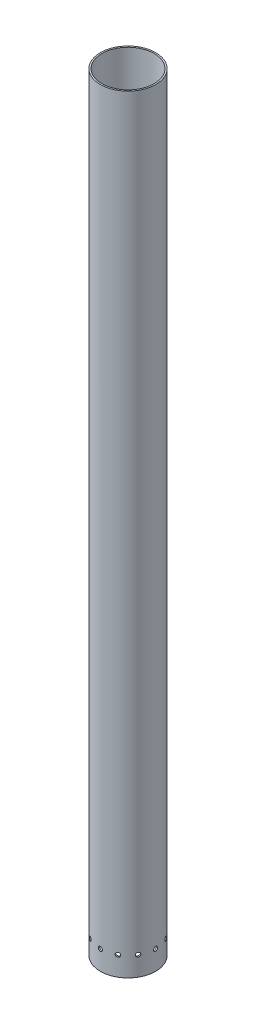
from build123d import *

# Parameters (mm, degrees)
SKETCH1_W         = 1.4732
SKETCH1_H         = 749.3
CIRPATTERN1_COUNT = 12


with BuildPart() as part:
    # Sketch1 → Revolve1 (revolve)
    with BuildSketch(Plane.XY):
        with Locations((26.2509, -357.364188343)):
            Rectangle(SKETCH1_W, SKETCH1_H)
    revolve(axis=Axis((0, 0, 0), (0, 1, 0)))

    # Sketch3 → #10-32 Tapped Hole1 (revolve, cut)
    with BuildSketch(Plane(origin=(0, -712.964188343, -26.9875), x_dir=(0, 1, 0), z_dir=(1, 0, 0))):
        Polygon((0, 0), (0, 15.183317848), (2.0193, 13.97), (2.0193, 0), align=None)
    f_10_32_tapped_hole1 = revolve(axis=Axis((0, -712.964188343, -33.3375), (0, 0, 1)), mode=Mode.SUBTRACT)

    # CirPattern1: #10-32 Tapped Hole1 ×12 about axis
    cirpattern1_axis = Axis((0, 0, 0), (0, -1, 0))
    for i in range(1, CIRPATTERN1_COUNT):
        add(f_10_32_tapped_hole1.rotate(cirpattern1_axis, i * 360 / CIRPATTERN1_COUNT), mode=Mode.SUBTRACT)


solid = part.part
